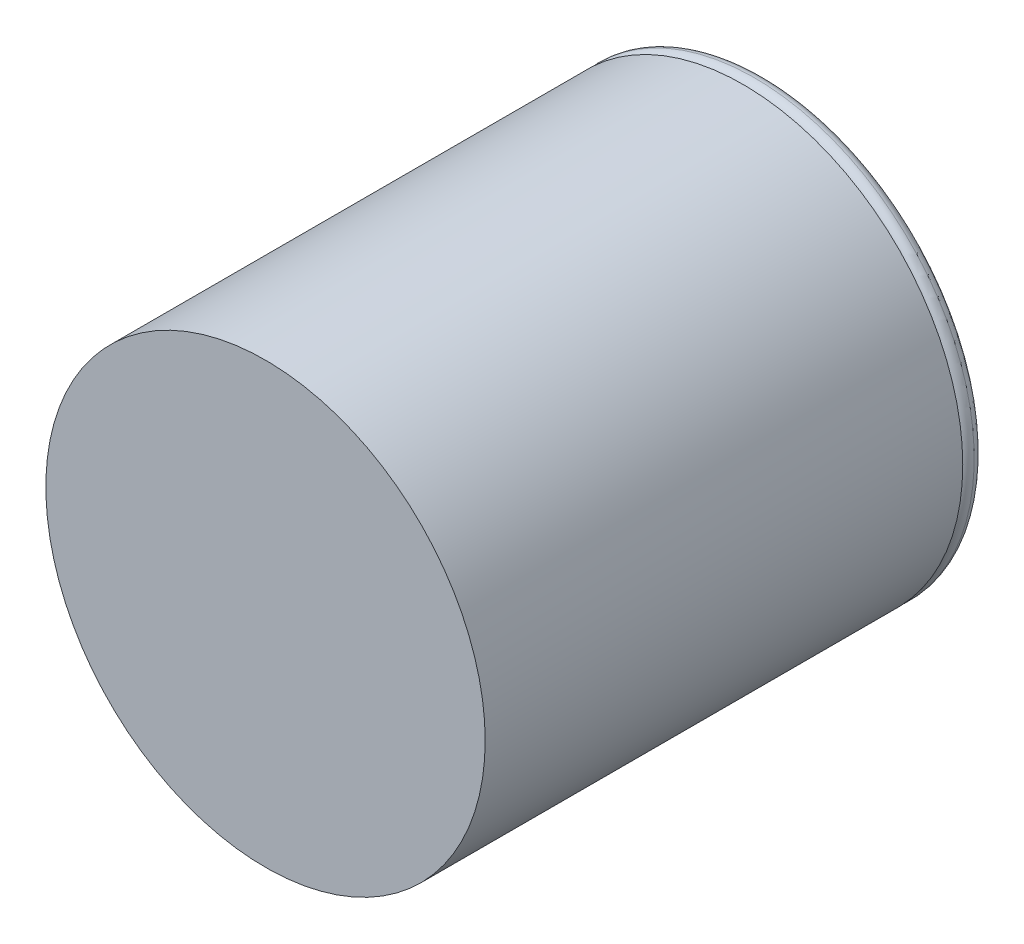
from build123d import *

# Parameters (mm, degrees)
SKETCH_1_R          = 11.5
EXTRUDE_1_DEPTH     = 25
SKETCH_2_R          = 7.5
EXTRUDE_2_DEPTH     = 0.1
EXTRUDE_START       = 1
SKETCH_3_R          = 11.5
EXTRUDE_3_DEPTH     = 1
FILLET_1_R          = 0.5
FILLET_2_R          = 0.5
SKETCH_4_R          = 2.5
CUT_EXTRUDE_1_DEPTH = 0.5
CHAMFER_1_SIZE      = 0.5


# Some blends are built 0.0001 mm under size
with BuildPart() as part:
    # 草图1 → 凸台-拉伸1 (new body)
    with BuildSketch(Plane.XY):
        Circle(SKETCH_1_R)
    extrude(amount=EXTRUDE_1_DEPTH)

    # 草图2 → 凸台-拉伸2 (add)
    with BuildSketch(Plane(origin=(0, 0, 0), x_dir=(-1, 0, 0), z_dir=(0, 0, -1))):
        Circle(SKETCH_2_R)
    extrude(amount=EXTRUDE_2_DEPTH)

    # 草图3 → 凸台-拉伸3 (add)
    with BuildSketch(Plane(origin=(0, 0, -0.1), x_dir=(-1, 0, 0), z_dir=(0, 0, -1)).offset(EXTRUDE_START)):
        with Locations(Location((0, 0, 0), (0, 0, 180))):
            Circle(SKETCH_3_R)
    extrude(amount=-EXTRUDE_3_DEPTH)

    # 圆角1
    fillet_1_edges = [part.edges().sort_by_distance(p)[0] for p in [
        (-11.5, 0, -1.1),
    ]]
    fillet(fillet_1_edges, radius=FILLET_1_R)

    # 圆角2
    # the kernel refuses this fillet: 0.5 mm, written as the material it adds along each edge
    with BuildSketch(Plane(origin=(0, 0, -0.1), x_dir=(-1, 0, 0), z_dir=(0, -1, 0))) as fillet_2_piece_1:
        with BuildLine():
            CenterArc((7.8, -0.5), FILLET_2_R, 90, 36.869897646)
            Line((7.5, -0.1), (7.5, 0))
            Line((7.5, 0), (7.8, 0))
        make_face()
    revolve(axis=Axis((0, 0, -0.1), (0, 0, -1)))
    # the kernel refuses this fillet: 0.5 mm, written as the material it takes off along each edge
    with BuildSketch(Plane(origin=(0, 0, -0.1), x_dir=(1, 0, 0), z_dir=(0, 1, 0))) as fillet_2_2_piece_1:
        with BuildLine():
            CenterArc((11.5 - FILLET_2_R, FILLET_2_R), FILLET_2_R, 270, 90)
            Line((11.5 - FILLET_2_R, 0), (11.5, 0))
            Line((11.5, 0), (11.5, FILLET_2_R))
        make_face()
    revolve(axis=Axis((0, 0, -0.1), (0, 0, -1)), mode=Mode.SUBTRACT)

    # 草图4 → 切除-拉伸1 (cut)
    with BuildSketch(Plane(origin=(0, 0, -1.1), x_dir=(-1, 0, 0), z_dir=(0, 0, -1))):
        Circle(SKETCH_4_R)
    extrude(amount=-CUT_EXTRUDE_1_DEPTH, mode=Mode.SUBTRACT)

    # 倒角1
    chamfer_1_edges = [part.edges().sort_by_distance(p)[0] for p in [
        (2.5, 0, -0.6),
    ]]
    chamfer(chamfer_1_edges, length=CHAMFER_1_SIZE - 0.0001)  # a hair under: the kernel refuses the full size


solid = part.part
